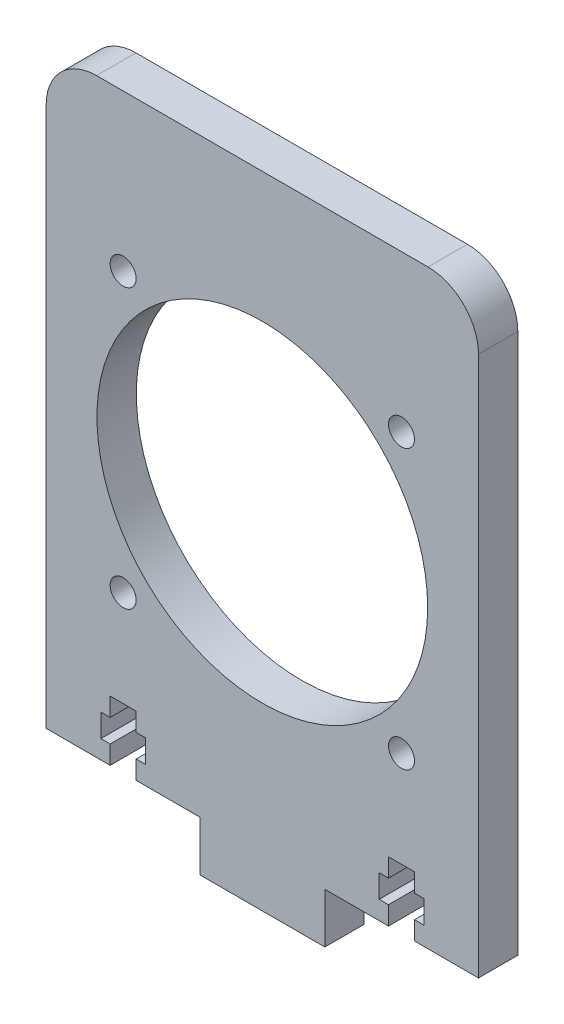
from build123d import *

# Parameters (mm, degrees)
SKETCH1_W           = 109.8
SKETCH1_H           = 150
SKETCH1_R           = 3.3
SKETCH1_R_2         = 42
BOSS_EXTRUDE1_DEPTH = 10
CUT_EXTRUDE1_DEPTH  = 94.482672191
BOSS_EXTRUDE2_DEPTH = 12.7
FILLET1_R           = 12.8


with BuildPart() as part:
    # Sketch1 → Boss-Extrude1 (new body)
    with BuildSketch(Plane.XY):
        Rectangle(SKETCH1_W, SKETCH1_H)
        with Locations((-35.355339059, -35.355339059)):
            Circle(SKETCH1_R, mode=Mode.SUBTRACT)
        with Locations((35.355339059, -35.355339059)):
            Circle(SKETCH1_R, mode=Mode.SUBTRACT)
        with Locations((-35.355339059, 35.355339059)):
            Circle(SKETCH1_R, mode=Mode.SUBTRACT)
        Circle(SKETCH1_R_2, mode=Mode.SUBTRACT)
        with Locations((35.355339059, 35.355339059)):
            Circle(SKETCH1_R, mode=Mode.SUBTRACT)
    extrude(amount=BOSS_EXTRUDE1_DEPTH)

    # Sketch2 → Cut-Extrude1 (cut, through all)
    with BuildSketch(Plane(origin=(0, 0, 0), x_dir=(-1, 0, 0), z_dir=(0, 0, -1))):
        Polygon((32.05, -70.3), (32.05, -75), (38.65, -75), (38.65, -70.3), (41.014, -70.3), (41.014, -64.46), (38.65, -64.46), (38.65, -59.76), (32.05, -59.76), (32.05, -64.46), (29.686, -64.46), (29.686, -70.3), align=None)
        Polygon((-38.65, -75), (-32.05, -75), (-32.05, -70.3), (-29.686, -70.3), (-29.686, -64.46), (-32.05, -64.46), (-32.05, -59.76), (-38.65, -59.76), (-38.65, -64.46), (-41.014, -64.46), (-41.014, -70.3), (-38.65, -70.3), align=None)
    extrude(amount=-CUT_EXTRUDE1_DEPTH, mode=Mode.SUBTRACT)

    # Sketch4 → Boss-Extrude2 (add)
    with BuildSketch(Plane.XZ.offset(75)):
        Polygon((0, 0), (15.875, 0), (15.875, 10), (-15.875, 10), (-15.875, 0), align=None)
    extrude(amount=BOSS_EXTRUDE2_DEPTH)

    # Fillet1
    fillet1_edges = [part.edges().sort_by_distance(p)[0] for p in [
        (-54.9, 75, 5),
        (54.9, 75, 5),
    ]]
    fillet(fillet1_edges, radius=FILLET1_R)


solid = part.part
